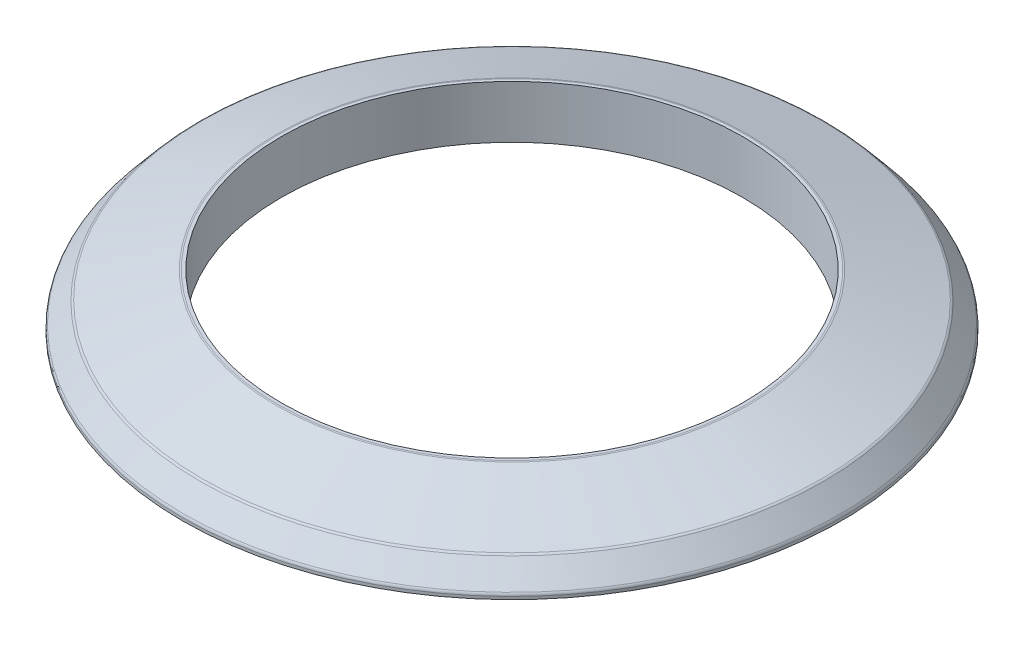
from build123d import *

# Parameters (mm, degrees)
SKETCH1_R       = 19.05
SKETCH1_R_2     = 13.335
EXTRUDE1_DEPTH  = 1.524
CHAMFER1_SIZE   = 1.27
CHAMFER1_SIZE2  = 1.065656532
SKETCH2_R       = 17.984343468
SKETCH2_R_2     = 13.335
EXTRUDE2_DEPTH  = 1.524
CHAMFER2_SIZE   = 4.426017378
CHAMFER2_SIZE_2 = 1.524
FILLET1_R       = 0.254


with BuildPart() as part:
    # Sketch1 → Extrude1 (new body)
    with BuildSketch(Plane(origin=(0, 0, 0), x_dir=(1, 0, 0), z_dir=(0, 1, 0))):
        with Locations(Location((0, 0, 0), (0, 0, 90))):
            Circle(SKETCH1_R)
        with Locations(Location((0, 0, 0), (0, 0, 90))):
            Circle(SKETCH1_R_2, mode=Mode.SUBTRACT)
    extrude(amount=EXTRUDE1_DEPTH)

    # Chamfer1
    chamfer1_edges = [part.edges().sort_by_distance(p)[0] for p in [
        (0, 1.524, 19.05),
    ]]
    chamfer1_side = [part.faces().sort_by_distance(p)[0] for p in [
        (0, 0.762, 19.05),
    ]]
    chamfer(chamfer1_edges, length=CHAMFER1_SIZE, length2=CHAMFER1_SIZE2, reference=chamfer1_side[0])

    # Sketch2 → Extrude2 (add)
    with BuildSketch(Plane(origin=(0, 1.524, 0), x_dir=(-1, 0, 0), z_dir=(0, 1, 0))):
        with Locations(Location((0, 0, 0), (0, 0, 270))):
            Circle(SKETCH2_R)
        with Locations(Location((0, 0, 0), (0, 0, 270))):
            Circle(SKETCH2_R_2, mode=Mode.SUBTRACT)
    extrude(amount=EXTRUDE2_DEPTH)

    # Chamfer2
    # the kernel refuses this chamfer: 4.426017378, 1.524 mm, written as the material it takes off along each edge
    with BuildSketch(Plane(origin=(0, 3.048, 0), x_dir=(0, 0, -1), z_dir=(1, 0, 0))) as chamfer2_piece_1:
        Polygon((17.984343468 - CHAMFER2_SIZE, 0), (17.984343468, -CHAMFER2_SIZE_2), (17.984343468, 0), align=None)
    revolve(axis=Axis((0, 3.048, 0), (0, 1, 0)), mode=Mode.SUBTRACT)

    # Fillet1
    fillet1_edges = [part.edges().sort_by_distance(p)[0] for p in [
        (0, 3.048, 13.55832609),
        (0, 1.524, 17.984343468),
        (0, 0.254, 19.05),
    ]]
    fillet(fillet1_edges, radius=FILLET1_R)


solid = part.part
